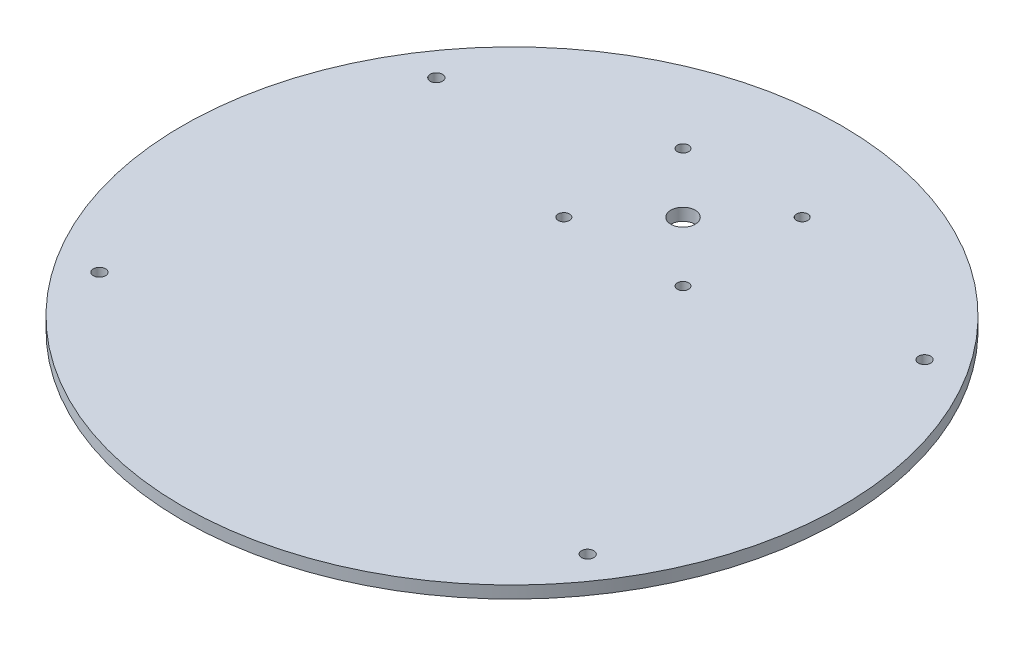
from build123d import *

# Parameters (mm, degrees)
SKETCH1_R           = 85.725
BOSS_EXTRUDE1_DEPTH = 3.175
CUT_EXTRUDE1_REACH  = 123.275
SKETCH2_R           = 1.5875
CUT_EXTRUDE2_REACH  = 123.275
SKETCH3_R           = 3.175
CUT_EXTRUDE3_REACH  = 123.275
SKETCH5_R           = 1.4732


with BuildPart() as part:
    # Sketch1 → Boss-Extrude1 (new body)
    with BuildSketch(Plane(origin=(0, 0, 0), x_dir=(1, 0, 0), z_dir=(0, 1, 0))):
        Circle(SKETCH1_R)
    extrude(amount=BOSS_EXTRUDE1_DEPTH)

    # Sketch2 → Cut-Extrude1 (cut, up to next)
    with BuildSketch(Plane(origin=(0, 3.175, 0), x_dir=(1, 0, 0), z_dir=(0, 1, 0)), mode=Mode.PRIVATE) as cut_extrude1_sk1:
        with Locations((-63.5, 43.815)):
            Circle(SKETCH2_R)
    cut_extrude1_tool1 = extrude(cut_extrude1_sk1.sketch, amount=-CUT_EXTRUDE1_REACH, mode=Mode.PRIVATE) & part.part
    # Sketch2 → Cut-Extrude1 (cut, up to next)
    with BuildSketch(Plane(origin=(0, 3.175, 0), x_dir=(1, 0, 0), z_dir=(0, 1, 0)), mode=Mode.PRIVATE) as cut_extrude1_sk2:
        with Locations((63.5, 43.815)):
            Circle(SKETCH2_R)
    cut_extrude1_tool2 = extrude(cut_extrude1_sk2.sketch, amount=-CUT_EXTRUDE1_REACH, mode=Mode.PRIVATE) & part.part
    # Sketch2 → Cut-Extrude1 (cut, up to next)
    with BuildSketch(Plane(origin=(0, 3.175, 0), x_dir=(1, 0, 0), z_dir=(0, 1, 0)), mode=Mode.PRIVATE) as cut_extrude1_sk3:
        with Locations((-63.5, -43.815)):
            Circle(SKETCH2_R)
    cut_extrude1_tool3 = extrude(cut_extrude1_sk3.sketch, amount=-CUT_EXTRUDE1_REACH, mode=Mode.PRIVATE) & part.part
    # Sketch2 → Cut-Extrude1 (cut, up to next)
    with BuildSketch(Plane(origin=(0, 3.175, 0), x_dir=(1, 0, 0), z_dir=(0, 1, 0)), mode=Mode.PRIVATE) as cut_extrude1_sk4:
        with Locations((63.5, -43.815)):
            Circle(SKETCH2_R)
    cut_extrude1_tool4 = extrude(cut_extrude1_sk4.sketch, amount=-CUT_EXTRUDE1_REACH, mode=Mode.PRIVATE) & part.part
    add(cut_extrude1_tool1.solids().sort_by_distance((-63.5, 3.175, -43.815))[0], mode=Mode.SUBTRACT)
    add(cut_extrude1_tool2.solids().sort_by_distance((63.5, 3.175, -43.815))[0], mode=Mode.SUBTRACT)
    add(cut_extrude1_tool3.solids().sort_by_distance((-63.5, 3.175, 43.815))[0], mode=Mode.SUBTRACT)
    add(cut_extrude1_tool4.solids().sort_by_distance((63.5, 3.175, 43.815))[0], mode=Mode.SUBTRACT)

    # Sketch3 → Cut-Extrude2 (cut, up to next)
    with BuildSketch(Plane(origin=(0, 3.175, 0), x_dir=(1, 0, 0), z_dir=(0, 1, 0)), mode=Mode.PRIVATE) as cut_extrude2_sk1:
        with Locations((0, 44.482150941)):
            Circle(SKETCH3_R)
    cut_extrude2_tool1 = extrude(cut_extrude2_sk1.sketch, amount=-CUT_EXTRUDE2_REACH, mode=Mode.PRIVATE) & part.part
    add(cut_extrude2_tool1.solids().sort_by_distance((0, 3.175, -44.482151))[0], mode=Mode.SUBTRACT)

    # Sketch5 → Cut-Extrude3 (cut, up to next)
    with BuildSketch(Plane(origin=(0, 3.175, 0), x_dir=(1, 0, 0), z_dir=(0, 1, 0)), mode=Mode.PRIVATE) as cut_extrude3_sk1:
        with Locations((-15.50035, 59.982500941)):
            Circle(SKETCH5_R)
    cut_extrude3_tool1 = extrude(cut_extrude3_sk1.sketch, amount=-CUT_EXTRUDE3_REACH, mode=Mode.PRIVATE) & part.part
    # Sketch5 → Cut-Extrude3 (cut, up to next)
    with BuildSketch(Plane(origin=(0, 3.175, 0), x_dir=(1, 0, 0), z_dir=(0, 1, 0)), mode=Mode.PRIVATE) as cut_extrude3_sk2:
        with Locations((15.50035, 59.982500941)):
            Circle(SKETCH5_R)
    cut_extrude3_tool2 = extrude(cut_extrude3_sk2.sketch, amount=-CUT_EXTRUDE3_REACH, mode=Mode.PRIVATE) & part.part
    # Sketch5 → Cut-Extrude3 (cut, up to next)
    with BuildSketch(Plane(origin=(0, 3.175, 0), x_dir=(1, 0, 0), z_dir=(0, 1, 0)), mode=Mode.PRIVATE) as cut_extrude3_sk3:
        with Locations((-15.50035, 28.981800941)):
            Circle(SKETCH5_R)
    cut_extrude3_tool3 = extrude(cut_extrude3_sk3.sketch, amount=-CUT_EXTRUDE3_REACH, mode=Mode.PRIVATE) & part.part
    # Sketch5 → Cut-Extrude3 (cut, up to next)
    with BuildSketch(Plane(origin=(0, 3.175, 0), x_dir=(1, 0, 0), z_dir=(0, 1, 0)), mode=Mode.PRIVATE) as cut_extrude3_sk4:
        with Locations((15.50035, 28.981800941)):
            Circle(SKETCH5_R)
    cut_extrude3_tool4 = extrude(cut_extrude3_sk4.sketch, amount=-CUT_EXTRUDE3_REACH, mode=Mode.PRIVATE) & part.part
    add(cut_extrude3_tool1.solids().sort_by_distance((-15.50035, 3.175, -59.982501))[0], mode=Mode.SUBTRACT)
    add(cut_extrude3_tool2.solids().sort_by_distance((15.50035, 3.175, -59.982501))[0], mode=Mode.SUBTRACT)
    add(cut_extrude3_tool3.solids().sort_by_distance((-15.50035, 3.175, -28.981801))[0], mode=Mode.SUBTRACT)
    add(cut_extrude3_tool4.solids().sort_by_distance((15.50035, 3.175, -28.981801))[0], mode=Mode.SUBTRACT)


solid = part.part
